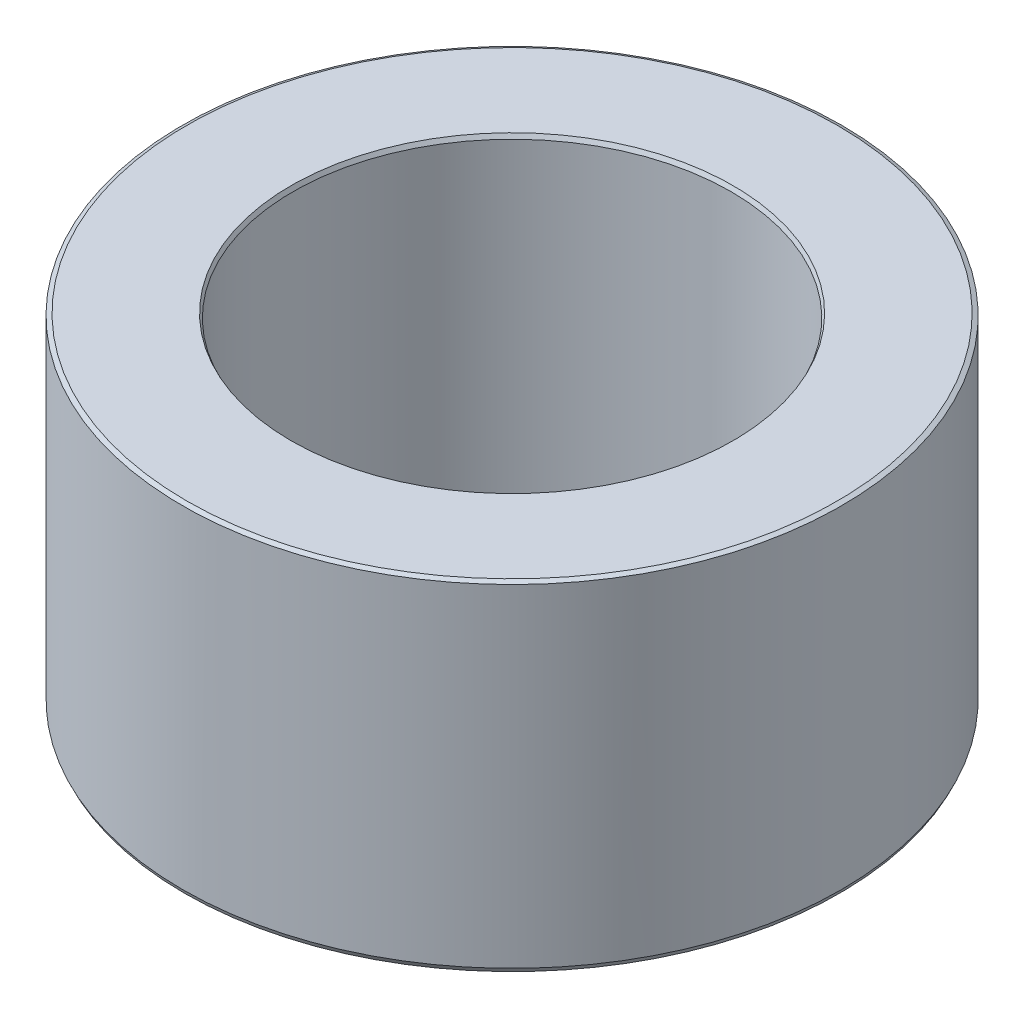
from build123d import *
from OCP.BRepFilletAPI import BRepFilletAPI_MakeChamfer

# Parameters (mm, degrees)
SKETCH1_R           = 40
BOSS_EXTRUDE1_DEPTH = 41.096579107
SKETCH2_R           = 26.583925181
CUT_EXTRUDE1_DEPTH  = 70.920875383
CHAMFER1_SIZE       = 0.240437254
CHAMFER1_SIZE2      = 0.514580159


with BuildPart() as part:
    # Sketch1 → Boss-Extrude1 (new body)
    with BuildSketch(Plane(origin=(0, 0, 0), x_dir=(1, 0, 0), z_dir=(0, 1, 0))):
        Circle(SKETCH1_R)
    extrude(amount=BOSS_EXTRUDE1_DEPTH)

    # Sketch2 → Cut-Extrude1 (cut, through all)
    with BuildSketch(Plane(origin=(0, 0, 0), x_dir=(1, 0, 0), z_dir=(0, 1, 0))):
        Circle(SKETCH2_R)
    extrude(amount=CUT_EXTRUDE1_DEPTH, mode=Mode.SUBTRACT)

    # Chamfer1: one chamfer whose edges measure the first distance from different faces: ONE call of the kernel's chamfer builder (chamfer() names one face for all edges)
    chamfer1_edges_1 = [part.edges().sort_by_distance(p)[0] for p in [
        (-26.583925181, 41.096579107, 0),
    ]]
    chamfer1_side_1 = [part.faces().sort_by_distance(p)[0] for p in [
        (-38.86862915, 41.096579107, 0),
    ]]
    chamfer1_edges_2 = [part.edges().sort_by_distance(p)[0] for p in [
        (-26.583925181, 0, 0),
    ]]
    chamfer1_side_2 = [part.faces().sort_by_distance(p)[0] for p in [
        (-26.583925181, 20.548289553, 0),
    ]]
    chamfer1_edges_3 = [part.edges().sort_by_distance(p)[0] for p in [
        (-40, 0, 0),
    ]]
    chamfer1_side_3 = [part.faces().sort_by_distance(p)[0] for p in [
        (-38.86862915, 0, 0),
    ]]
    chamfer1_edges_4 = [part.edges().sort_by_distance(p)[0] for p in [
        (-40, 41.096579107, 0),
    ]]
    chamfer1_side_4 = [part.faces().sort_by_distance(p)[0] for p in [
        (-40, 20.548289553, 0),
    ]]
    chamfer1 = BRepFilletAPI_MakeChamfer(part.part.solid().wrapped)
    for e in chamfer1_edges_1:
        chamfer1.Add(CHAMFER1_SIZE, CHAMFER1_SIZE2, e.wrapped, chamfer1_side_1[0].wrapped)  # the first distance lies on this face
    for e in chamfer1_edges_2:
        chamfer1.Add(CHAMFER1_SIZE, CHAMFER1_SIZE2, e.wrapped, chamfer1_side_2[0].wrapped)  # the first distance lies on this face
    for e in chamfer1_edges_3:
        chamfer1.Add(CHAMFER1_SIZE, CHAMFER1_SIZE2, e.wrapped, chamfer1_side_3[0].wrapped)  # the first distance lies on this face
    for e in chamfer1_edges_4:
        chamfer1.Add(CHAMFER1_SIZE, CHAMFER1_SIZE2, e.wrapped, chamfer1_side_4[0].wrapped)  # the first distance lies on this face
    add(Compound.cast(chamfer1.Shape()), mode=Mode.REPLACE)


solid = part.part
